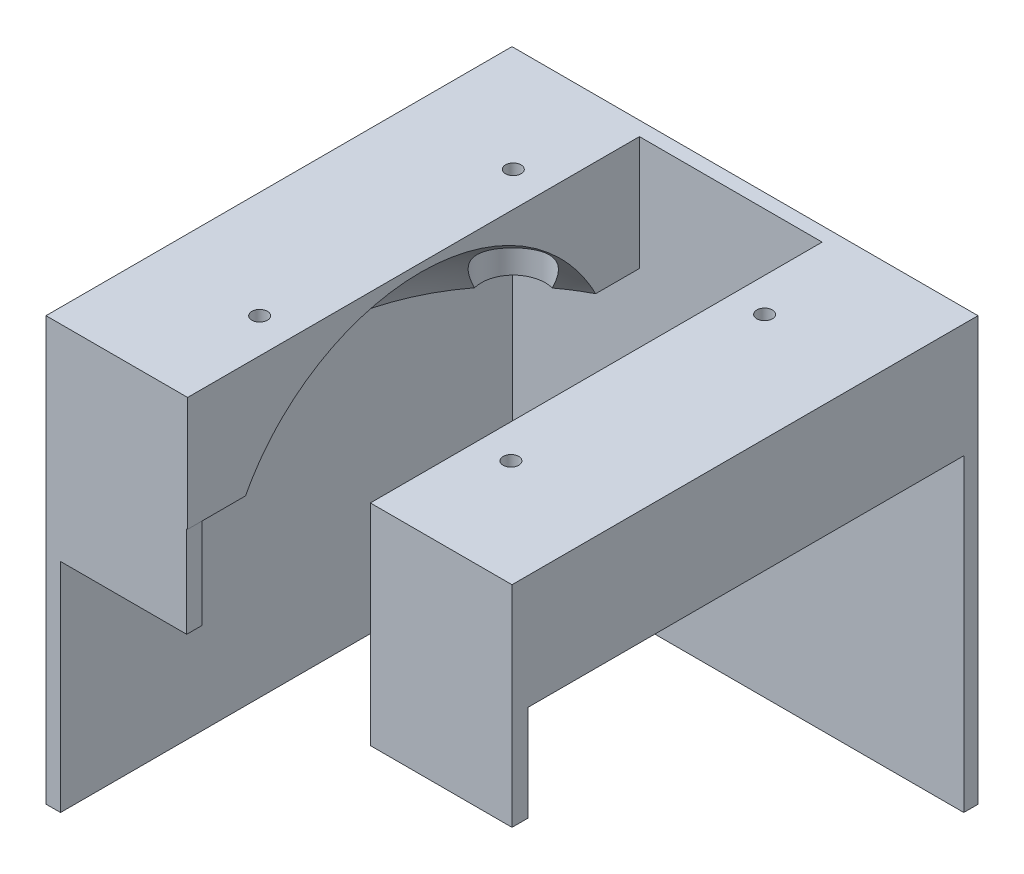
from build123d import *
from build123d.topology import SkipClean

# Parameters (mm, degrees)
SKETCH1_W                   = 102
SKETCH1_H                   = 102
BOSS_EXTRUDE1_DEPTH         = 50
CUT_EXTRUDE_THIN1_OUTLINE_W = 40
CUT_EXTRUDE_THIN1_OUTLINE_H = 95.773670058
CUT_EXTRUDE_THIN1_DEPTH     = 50
SKETCH4_W                   = 40
SKETCH4_H                   = 6.202657501
CUT_EXTRUDE3_DEPTH          = 54
SKETCH5_W                   = 33.817621941
SKETCH5_H                   = 102.594578927
CUT_EXTRUDE4_DEPTH          = 20
SKETCH6_W                   = 27.820383201
SKETCH6_H                   = 98.886835029
CUT_EXTRUDE5_DEPTH          = 20
SKETCH7_W                   = 30.8
SKETCH7_H                   = 3.364819678
BOSS_EXTRUDE2_DEPTH         = 21
SKETCH9_W                   = 31
SKETCH9_H                   = 3.479961613
BOSS_EXTRUDE4_DEPTH         = 21
SKETCH11_W                  = 98.820383201
SKETCH11_H                  = 3.113164971
BOSS_EXTRUDE6_DEPTH         = 47.625
SKETCH14_W                  = 102
SKETCH14_H                  = 5
CUT_EXTRUDE7_DEPTH          = 105
SKETCH17_R                  = 7
CUT_EXTRUDE12_DEPTH         = 20.5
M3_CLEARANCE_HOLE1_D        = 3.4
SKETCH22_W                  = 3.179616799
SKETCH22_H                  = 102
BOSS_EXTRUDE7_DEPTH         = 47.6


# Read off the part's stored shape, not the designer's step: Cut-Extrude-Thin1
with BuildPart() as part:
    # Sketch1 → Boss-Extrude1 (new body)
    with BuildSketch(Plane(origin=(0, 0, 0), x_dir=(1, 0, 0), z_dir=(0, 1, 0))):
        with Locations((-66.567363259, 25.977216604)):
            Rectangle(SKETCH1_W, SKETCH1_H)
    extrude(amount=BOSS_EXTRUDE1_DEPTH)

    # Sketch2 → Cut-Revolve1 (revolve, cut)
    with SkipClean():  # the faces are left unmerged after this step: merging them gives an invalid solid
        with BuildSketch(Plane(origin=(0, 0, 0), x_dir=(1, 0, 0), z_dir=(0, 1, 0))):
            with BuildLine():
                ThreePointArc((-66.567363259, 73.602216604), (-114.192363259, 25.977216604), (-66.567363259, -21.647783396))
                Line((-66.567363259, -21.647783396), (-66.567363259, 73.602216604))
            make_face()
            with BuildLine():
                Line((-66.567363259, 73.602216604), (-66.567363259, -21.647783396))
                ThreePointArc((-66.567363259, -21.647783396), (-32.891402805, -7.69874385), (-18.942363259, 25.977216604))
                ThreePointArc((-18.942363259, 25.977216604), (-32.891402805, 59.653177058), (-66.567363259, 73.602216604))
            make_face()
        revolve(axis=Axis((-66.567363259, 0, 21.647783396), (0, 0, -1)), mode=Mode.SUBTRACT)
    add(part.part.scale(1), mode=Mode.REPLACE)  # the faces are merged on a copy

    # Cut-Extrude-Thin1 outline → Cut-Extrude-Thin1 (cut)
    with BuildSketch(Plane(origin=(0, 0, 0), x_dir=(1, 0, 0), z_dir=(0, 1, 0))):
        with Locations((-66.567363259, 25.977216604)):
            Rectangle(CUT_EXTRUDE_THIN1_OUTLINE_W, CUT_EXTRUDE_THIN1_OUTLINE_H)
    extrude(amount=CUT_EXTRUDE_THIN1_DEPTH, mode=Mode.SUBTRACT)

    # Sketch4 → Cut-Extrude3 (cut)
    with BuildSketch(Plane(origin=(0, 0, 0), x_dir=(1, 0, 0), z_dir=(0, 1, 0))):
        with Locations((-66.567363259, -25.010947176)):
            Rectangle(SKETCH4_W, SKETCH4_H)
    extrude(amount=CUT_EXTRUDE3_DEPTH, mode=Mode.SUBTRACT)

    # Sketch5 → Cut-Extrude4 (cut)
    with BuildSketch(Plane(origin=(0, 0, 0), x_dir=(1, 0, 0), z_dir=(0, 1, 0))):
        with Locations((-29.658552289, 22.56676217)):
            Rectangle(SKETCH5_W, SKETCH5_H)
    extrude(amount=CUT_EXTRUDE4_DEPTH, mode=Mode.SUBTRACT)

    # Sketch6 → Cut-Extrude5 (cut)
    with BuildSketch(Plane(origin=(0, 0, 0), x_dir=(-1, 0, 0), z_dir=(0, -1, 0))):
        with Locations((100.47755486, 24.420634119)):
            Rectangle(SKETCH6_W, SKETCH6_H)
    extrude(amount=-CUT_EXTRUDE5_DEPTH, mode=Mode.SUBTRACT)

    # Sketch7 → Boss-Extrude2 (add)
    with BuildSketch(Plane(origin=(0, 0, 0), x_dir=(1, 0, 0), z_dir=(0, 1, 0))):
        with Locations((-102.167363259, -23.340373557)):
            Rectangle(SKETCH7_W, SKETCH7_H)
    extrude(amount=BOSS_EXTRUDE2_DEPTH)

    # Sketch9 → Boss-Extrude4 (add)
    with BuildSketch(Plane.XZ.offset(-20)):
        with Locations((-31.067363259, 23.28280259)):
            Rectangle(SKETCH9_W, SKETCH9_H)
    extrude(amount=BOSS_EXTRUDE4_DEPTH)

    # Sketch11 → Boss-Extrude6 (add)
    with BuildSketch(Plane.XZ):
        with Locations((-64.97755486, -75.420634119)):
            Rectangle(SKETCH11_W, SKETCH11_H)
    extrude(amount=BOSS_EXTRUDE6_DEPTH)

    # Sketch14 → Cut-Extrude7 (cut)
    with BuildSketch(Plane(origin=(-15.567363259, 0, 0), x_dir=(0, 0, -1), z_dir=(1, 0, 0))):
        with Locations((25.977216604, 47.5)):
            Rectangle(SKETCH14_W, SKETCH14_H)
    extrude(amount=-CUT_EXTRUDE7_DEPTH, mode=Mode.SUBTRACT)

    # Sketch17 → Cut-Extrude12 (cut)
    with BuildSketch(Plane.XZ.offset(-20)):
        with Locations(Location((-94.167363259, 1.657963718, 0), (0, 0, 270))):
            Circle(SKETCH17_R)
        with Locations(Location((-94.167363259, -53.864051633, 0), (0, 0, 284.685382437))):
            Circle(SKETCH17_R)
        with Locations(Location((-39.167363259, 1.657963718, 0), (0, 0, 349.246729183))):
            Circle(SKETCH17_R)
        with Locations(Location((-39.167363259, -53.864051633, 0), (0, 0, 270))):
            Circle(SKETCH17_R)
    extrude(amount=-CUT_EXTRUDE12_DEPTH, mode=Mode.SUBTRACT)

    # M3 Clearance Hole1 (through all)
    with Locations(Plane(origin=(0, 40.5, 0), x_dir=(-1, 0, 0), z_dir=(0, -1, 0))):
        with Locations((94.167363259, -1.657963718), (39.167363259, -1.657963718), (39.167363259, 53.864051633), (94.167363259, 53.864051633)):
            Hole(M3_CLEARANCE_HOLE1_D / 2)

    # Sketch22 → Boss-Extrude7 (add)
    with BuildSketch(Plane.XZ):
        with Locations((-115.97755486, -25.977216604)):
            Rectangle(SKETCH22_W, SKETCH22_H)
    extrude(amount=BOSS_EXTRUDE7_DEPTH)


solid = part.part
